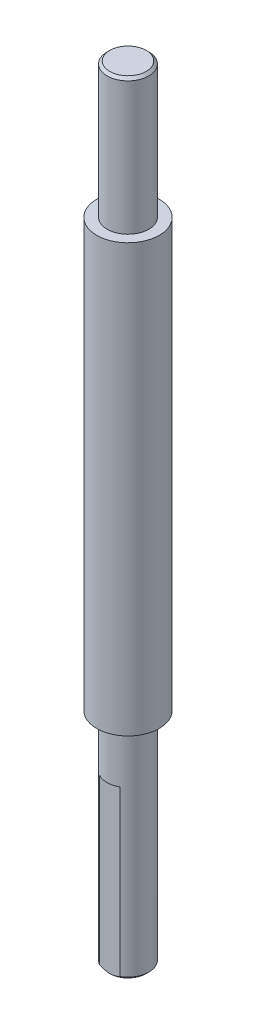
from build123d import *

# Parameters (mm, degrees)
SKETCH1_R           = 6
BOSS_EXTRUDE1_DEPTH = 150
SKETCH2_OUTSIDE_W   = 44.192
SKETCH2_OUTSIDE_H   = 44.192
SKETCH2_OUTSIDE_R   = 4
CUT_EXTRUDE1_DEPTH  = 26
SKETCH3_OUTSIDE_W   = 44.192
SKETCH3_OUTSIDE_H   = 44.192
SKETCH3_OUTSIDE_R   = 4
CUT_EXTRUDE2_DEPTH  = 42
SKETCH4_W           = 0.5
SKETCH4_H           = 32
CUT_EXTRUDE3_DEPTH  = 5
CHAMFER1_SIZE       = 0.5


with BuildPart() as part:
    # Sketch1 → Boss-Extrude1 (new body)
    with BuildSketch(Plane(origin=(0, 0, 0), x_dir=(1, 0, 0), z_dir=(0, 1, 0))):
        with Locations(Location((0, 0, 0), (0, 0, 270))):
            Circle(SKETCH1_R)
    extrude(amount=BOSS_EXTRUDE1_DEPTH)

    # Sketch2 outside → Cut-Extrude1 (cut)
    with BuildSketch(Plane(origin=(0, 150, 0), x_dir=(1, 0, 0), z_dir=(0, 1, 0))):
        Rectangle(SKETCH2_OUTSIDE_W, SKETCH2_OUTSIDE_H)
        with Locations(Location((0, 0, 0), (0, 0, 270))):
            Circle(SKETCH2_OUTSIDE_R, mode=Mode.SUBTRACT)
    extrude(amount=-CUT_EXTRUDE1_DEPTH, mode=Mode.SUBTRACT)

    # Sketch3 outside → Cut-Extrude2 (cut)
    with BuildSketch(Plane.XZ):
        Rectangle(SKETCH3_OUTSIDE_W, SKETCH3_OUTSIDE_H)
        with Locations(Location((0, 0, 0), (0, 0, 90))):
            Circle(SKETCH3_OUTSIDE_R, mode=Mode.SUBTRACT)
    extrude(amount=-CUT_EXTRUDE2_DEPTH, mode=Mode.SUBTRACT)

    # Sketch4 → Cut-Extrude3 (cut, symmetric)
    with BuildSketch(Plane(origin=(0, 0, 0), x_dir=(0, 0, -1), z_dir=(1, 0, 0))):
        with Locations((-3.75, 16)):
            Rectangle(SKETCH4_W, SKETCH4_H)
    extrude(amount=CUT_EXTRUDE3_DEPTH, both=True, mode=Mode.SUBTRACT)

    # Chamfer1
    chamfer1_edges = [part.edges().sort_by_distance(p)[0] for p in [
        (0, 0, -4),
        (0, 150, -4),
    ]]
    chamfer(chamfer1_edges, length=CHAMFER1_SIZE - 0.0001)  # a hair under: the kernel refuses the full size


solid = part.part
